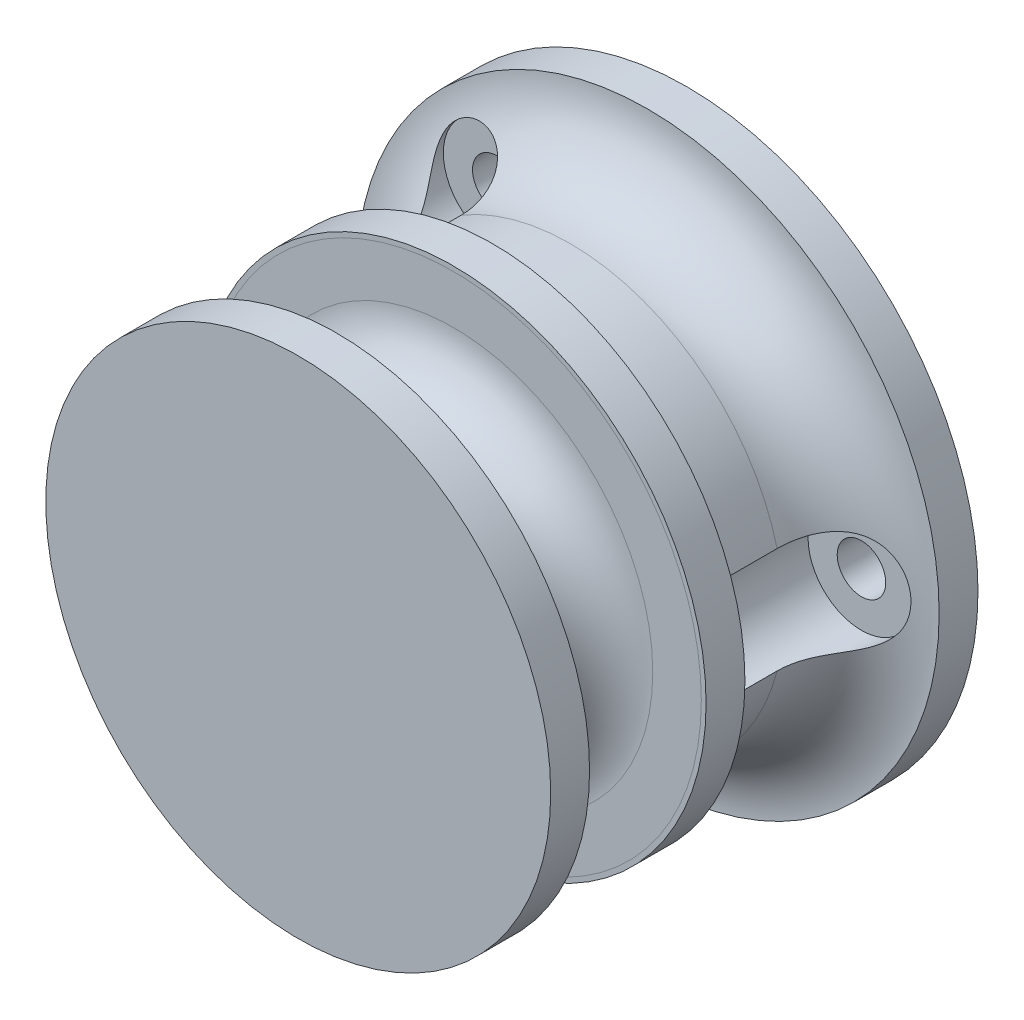
from build123d import *

# Parameters (mm, degrees)
SKETCH_1_R          = 15
EXTRUDE_1_DEPTH     = 10
SKETCH_3_R          = 2.85
CUT_EXTRUDE_1_DEPTH = 3.1
SKETCH_2_R          = 5.25
CUT_EXTRUDE_2_DEPTH = 2.4
SKETCH_5_R          = 13
EXTRUDE_2_DEPTH     = 10
SKETCH_11_W         = 4
SKETCH_11_H         = 8
FILLET_3_R          = 4
SKETCH_4_R          = 1.25
CUT_EXTRUDE_4_DEPTH = 2
SKETCH_12_R         = 2.75
SKETCH_12_R_2       = 2
CUT_EXTRUDE_5_DEPTH = 8
SKETCH_26_W         = 10
SKETCH_26_H         = 3
CUT_EXTRUDE_6_DEPTH = 2.5
SKETCH_29_R         = 0.8
FILLET_4_R          = 0.5
SKETCH_30_R         = 1.25
EXTRUDE_3_DEPTH     = 2


with BuildPart() as part:
    # 스케치1 → 보스-돌출1 (new body)
    with BuildSketch(Plane.XY):
        Circle(SKETCH_1_R)
    extrude(amount=EXTRUDE_1_DEPTH)

    # 스케치3 → 컷-돌출1 (cut)
    with BuildSketch(Plane.XY.offset(2.3)):
        with Locations(Location((0, 0, 0), (0, 0, 180))):
            Circle(SKETCH_3_R)
    extrude(amount=CUT_EXTRUDE_1_DEPTH, mode=Mode.SUBTRACT)

    # 스케치2 → 컷-돌출2 (cut)
    with BuildSketch(Plane(origin=(0, 0, 0), x_dir=(-1, 0, 0), z_dir=(0, 0, -1))):
        Circle(SKETCH_2_R)
    extrude(amount=-CUT_EXTRUDE_2_DEPTH, mode=Mode.SUBTRACT)

    # 스케치5 → 보스-돌출2 (add)
    with BuildSketch(Plane.XY.offset(10)):
        Circle(SKETCH_5_R)
    extrude(amount=EXTRUDE_2_DEPTH)

    # 컷-스윕2: sweep along a curve in space
    with BuildLine() as sweep_2_path:
        ThreePointArc((13, 0, 20), (9.192388155, 9.192388155, 20), (0, 13, 20))
        ThreePointArc((0, 13, 20), (-9.192388155, 9.192388155, 20), (-13, 0, 20))
        ThreePointArc((-13, 0, 20), (-9.192388155, -9.192388155, 20), (0, -13, 20))
        ThreePointArc((0, -13, 20), (9.192388155, -9.192388155, 20), (13, 0, 20))
    # 스케치10 → 컷-스윕2 (sweep, cut)
    with BuildSketch(Plane(origin=(0, 0, 0), x_dir=(1, 0, 0), z_dir=(0, 1, 0))):
        with BuildLine():
            Line((15, -18), (15, -12))
            Line((15, -12), (12.754407792, -12))
            Line((12.754407792, -12), (10.254407792, -12))
            ThreePointArc((10.254407792, -12), (7.254407792, -15), (10.254407792, -18))
            Line((10.254407792, -18), (15, -18))
        make_face()
    sweep(path=sweep_2_path.line, mode=Mode.SUBTRACT)

    # 컷-스윕3: sweep along a curve in space
    with BuildLine() as sweep_3_path:
        ThreePointArc((15, 0, 10), (10.606601718, 10.606601718, 10), (0, 15, 10))
        ThreePointArc((0, 15, 10), (-10.606601718, 10.606601718, 10), (-15, 0, 10))
        ThreePointArc((-15, 0, 10), (-10.606601718, -10.606601718, 10), (0, -15, 10))
        ThreePointArc((0, -15, 10), (10.606601718, -10.606601718, 10), (15, 0, 10))
    # 스케치11 → 컷-스윕3 (sweep, cut)
    with BuildSketch(Plane(origin=(0, 0, 0), x_dir=(1, 0, 0), z_dir=(0, 1, 0))):
        with Locations((13, -6)):
            Rectangle(SKETCH_11_W, SKETCH_11_H)
    sweep(path=sweep_3_path.line, mode=Mode.SUBTRACT)

    # 필렛3
    fillet_3_edges = [part.edges().sort_by_distance(p)[0] for p in [
        (0, 11, 2),
    ]]
    fillet(fillet_3_edges, radius=FILLET_3_R - 0.0001)  # a hair under: the kernel refuses the full size

    # 스케치4 → 컷-돌출4 (cut)
    with BuildSketch(Plane(origin=(0, 0, 0), x_dir=(-1, 0, 0), z_dir=(0, 0, -1))):
        with Locations((0, 11)):
            Circle(SKETCH_4_R)
        with Locations((7.778174593, 7.778174593)):
            Circle(SKETCH_4_R)
        with Locations((11, 0)):
            Circle(SKETCH_4_R)
        with Locations((7.778174593, -7.778174593)):
            Circle(SKETCH_4_R)
        with Locations((0, -11)):
            Circle(SKETCH_4_R)
        with Locations((-7.778174593, -7.778174593)):
            Circle(SKETCH_4_R)
        with Locations((-11, 0)):
            Circle(SKETCH_4_R)
        with Locations((-7.778174593, 7.778174593)):
            Circle(SKETCH_4_R)
    extrude(amount=-CUT_EXTRUDE_4_DEPTH, mode=Mode.SUBTRACT)

    # 스케치12 → 컷-돌출5 (cut)
    with BuildSketch(Plane(origin=(0, 0, 2), x_dir=(-1, 0, 0), z_dir=(0, 0, -1))):
        with Locations((-11, 0)):
            Circle(SKETCH_12_R)
        with Locations((7.778174593, 7.778174593)):
            Circle(SKETCH_12_R)
        with Locations((11, 0)):
            Circle(SKETCH_12_R_2)
        with Locations((7.778174593, -7.778174593)):
            Circle(SKETCH_12_R)
    extrude(amount=-CUT_EXTRUDE_5_DEPTH, mode=Mode.SUBTRACT)

    # 스케치26 → 컷-돌출6 (cut, symmetric)
    with BuildSketch(Plane(origin=(0, 0, 0), x_dir=(1, 0, 0), z_dir=(0, 1, 0))):
        with Locations((-9.291900756, -7.5)):
            Rectangle(SKETCH_26_W, SKETCH_26_H)
    extrude(amount=CUT_EXTRUDE_6_DEPTH, both=True, mode=Mode.SUBTRACT)

    # 컷-스윕30: sweep along a path in 스케치28
    with BuildLine(Plane(origin=(0, 0, 0), x_dir=(1, 0, 0), z_dir=(0, 1, 0))) as sweep_30_path:
        Line((-11, 0), (-11, -2))
        Line((-11, -2), (-11, -6.533577844))
        ThreePointArc((-11, -6.533577844), (-10.705022899, -7.242762383), (-9.994114577, -7.533560524))
        Line((-9.994114577, -7.533560524), (-5.393570244, -7.506483904))
        ThreePointArc((-5.393570244, -7.506483904), (-4.569805571, -7.616762546), (-3.807909683, -7.948823191))
        Line((-3.807909683, -7.948823191), (6.971836218, -14.557608755))
        ThreePointArc((6.971836218, -14.557608755), (7.725232095, -14.887284734), (8.539840508, -15))
        Line((8.539840508, -15), (10.254407792, -15))
    # 스케치29 → 컷-스윕30 (sweep, cut)
    with BuildSketch(Plane.XY):
        with Locations((-11, 0)):
            Circle(SKETCH_29_R)
    sweep(path=sweep_30_path.line, mode=Mode.SUBTRACT)

    # 필렛4
    fillet_4_edges = [part.edges().sort_by_distance(p)[0] for p in [
        (-10.301028645, -3.858601929, 10),
        (6.744896536, -8.689440184, 10),
        (4.209517756, 10.162674858, 10),
        (-10.301028645, 3.858601929, 10),
    ]]
    fillet(fillet_4_edges, radius=FILLET_4_R)

    # 스케치30 → 보스-돌출3 (add)
    with BuildSketch(Plane(origin=(0, 0, 0), x_dir=(-1, 0, 0), z_dir=(0, 0, -1))):
        with Locations((0, -11)):
            Circle(SKETCH_30_R)
        with Locations((-7.778174593, -7.778174593)):
            Circle(SKETCH_30_R)
        with Locations((0, 11)):
            Circle(SKETCH_30_R)
        with Locations((-7.778174593, 7.778174593)):
            Circle(SKETCH_30_R)
    extrude(amount=-EXTRUDE_3_DEPTH)


solid = part.part
